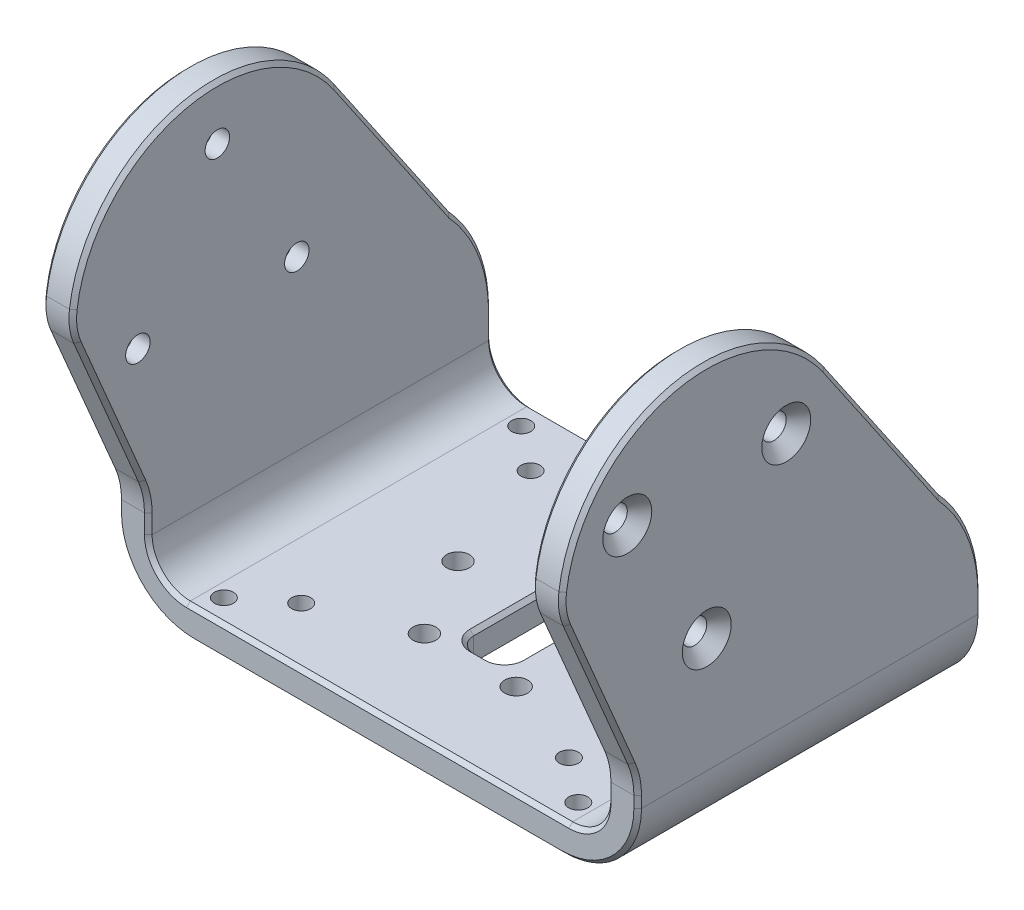
from build123d import *

# Parameters (mm, degrees)
SKETCH_1_W                   = 68
SKETCH_1_H                   = 45
EXTRUDE_1_DEPTH              = 4
SKETCH_2_R                   = 7
SKETCH_2_R_2                 = 1.6
EXTRUDE_2_DEPTH              = 4
FILLET_1_R                   = 20
FILLET_3_R                   = 5
FILLET_4_R                   = 10
FILLET_5_R                   = 10
EXTRUDE_5_DEPTH              = 4
EXTRUDE_START                = -4
EXTRUDE_6_DEPTH              = 4
FILLET_6_R                   = 8
SKETCH_34_R                  = 1.6
EXTRUDE_7_DEPTH              = 4
SKETCH_39_R                  = 7.5
CUT_EXTRUDE_5_DEPTH          = 10
HOLE_WIZARD_M3_2_OUTLINE_R   = 1.25
HOLE_WIZARD_M3_2_DEPTH       = 4
HOLE_WIZARD_M3_3_OUTLINE_R   = 1.25
HOLE_WIZARD_M3_3_DEPTH       = 4
CUT_EXTRUDE_6_REACH          = 98.711
SKETCH_53_W                  = 6.5
SKETCH_53_H                  = 14
FILLET_7_R                   = 1
HOLE_WIZARD_M3_8_D           = 3.2
HOLE_WIZARD_M3_8_DEPTH       = 6
HOLE_WIZARD_M3_8_CSINK_D     = 6.4
HOLE_WIZARD_M3_8_CSINK_ANGLE = 90
HOLE_WIZARD_M3_8_TIP         = 0.96137699
SKETCH_64_R                  = 1.6
EXTRUDE_10_DEPTH             = 4
SKETCH_58_R                  = 7.5
EXTRUDE_8_DEPTH              = 4
SKETCH_59_R                  = 7
EXTRUDE_9_DEPTH              = 4
SKETCH_61_W                  = 6.05
SKETCH_61_H                  = 17.9
CUT_EXTRUDE_7_DEPTH          = 10
FILLET_8_R                   = 2.03
CHAMFER_1_SIZE               = 0.5
CHAMFER_2_SIZE               = 0.5
FILLET_9_R                   = 10
CHAMFER_3_SIZE               = 0.5
CHAMFER_4_SIZE               = 0.5
SKETCH_45_R                  = 1.6
SKETCH_45_R_2                = 1.5
CUT_EXTRUDE_8_DEPTH          = 10
SKETCH_41_R                  = 1.5
CUT_EXTRUDE_9_DEPTH          = 10


# Read off the part's stored shape, not the designer's step: M3 螺纹孔2, M3 螺纹孔3, M3 十字槽半沉头木螺钉的锥形沉头孔7
with BuildPart() as part:
    # 草图1 → 凸台-拉伸1 (new body)
    with BuildSketch(Plane(origin=(0, 0, 0), x_dir=(1, 0, 0), z_dir=(0, 1, 0))):
        with Locations((34, 22.5)):
            Rectangle(SKETCH_1_W, SKETCH_1_H)
    extrude(amount=EXTRUDE_1_DEPTH)

    # 草图2 → 凸台-拉伸2 (add)
    with BuildSketch(Plane(origin=(68, 0, 0), x_dir=(0, 0, -1), z_dir=(1, 0, 0))):
        with BuildLine():
            Line((45, 0), (45, 20))
            Line((45, 20), (20.083304286, 47.143619407))
            ThreePointArc((20.083304286, 47.143619407), (1.609048893, 50.033934379), (-5.328161931, 32.66939756))
            Line((-5.328161931, 32.66939756), (0, 15))
            Line((0, 15), (0, 0))
            Line((0, 0), (45, 0))
        make_face()
        with Locations((9.033101332, 37)):
            Circle(SKETCH_2_R, mode=Mode.SUBTRACT)
        with Locations((9.033101332, 49)):
            Circle(SKETCH_2_R_2, mode=Mode.SUBTRACT)
        with Locations((19.425406178, 31)):
            Circle(SKETCH_2_R_2, mode=Mode.SUBTRACT)
        with Locations((-1.359203513, 31)):
            Circle(SKETCH_2_R_2, mode=Mode.SUBTRACT)
    extrude_2 = extrude(amount=-EXTRUDE_2_DEPTH)

    # 镜向1: 凸台-拉伸2 across plane
    add(extrude_2.mirror(Plane(origin=(34, 0, 0), x_dir=(0, 0, 1), z_dir=(1, 0, 0))))

    # 圆角1
    fillet_1_edges = [part.edges().sort_by_distance(p)[0] for p in [
        (66, 20, -45),
        (2, 20, -45),
    ]]
    fillet(fillet_1_edges, radius=FILLET_1_R)

    # 圆角3
    fillet_3_edges = [part.edges().sort_by_distance(p)[0] for p in [
        (64, 4, -22.5),
        (4, 4, -22.5),
    ]]
    fillet(fillet_3_edges, radius=FILLET_3_R)

    # 圆角4
    fillet_4_edges = [part.edges().sort_by_distance(p)[0] for p in [
        (68, 0, -22.5),
        (0, 0, -22.5),
    ]]
    fillet(fillet_4_edges, radius=FILLET_4_R)

    # 圆角5
    fillet_5_edges = [part.edges().sort_by_distance(p)[0] for p in [
        (66, 15, 0),
        (2, 15, 0),
    ]]
    fillet(fillet_5_edges, radius=FILLET_5_R)

    # 草图29 → 凸台-拉伸5 (add)
    with BuildSketch(Plane(origin=(68, 0, 0), x_dir=(0, 0, -1), z_dir=(1, 0, 0))):
        with BuildLine():
            Line((24.723058414, 47.715654286), (39.733603939, 25.737078944))
            Line((39.733603939, 25.737078944), (20.083304286, 47.143619407))
            ThreePointArc((20.083304286, 47.143619407), (1.609048893, 50.033934379), (-5.328161931, 32.66939756))
            Line((-5.328161931, 32.66939756), (-0.425824491, 16.412130924))
            ThreePointArc((-0.425824491, 16.412130924), (-0.107028882, 14.98421391), (0, 13.52506263))
            Line((0, 13.52506263), (-9.966898668, 37))
            ThreePointArc((-9.966898668, 37), (3.425480828, 55.153638541), (24.723058414, 47.715654286))
        make_face()
    extrude(amount=-EXTRUDE_5_DEPTH)

    # 草图30 → 凸台-拉伸6 (add)
    with BuildSketch(Plane.ZY.offset(EXTRUDE_START)):
        with BuildLine():
            Line((0, 13.52506263), (9.966898668, 37))
            ThreePointArc((9.966898668, 37), (-3.425480828, 55.153638541), (-24.723058414, 47.715654286))
            Line((-24.723058414, 47.715654286), (-39.733603939, 25.737078944))
            Line((-39.733603939, 25.737078944), (-20.083304286, 47.143619407))
            ThreePointArc((-20.083304286, 47.143619407), (-1.609048893, 50.033934379), (5.328161931, 32.66939756))
            Line((5.328161931, 32.66939756), (0.425824491, 16.412130924))
            ThreePointArc((0.425824491, 16.412130924), (0.107028882, 14.98421391), (0, 13.52506263))
        make_face()
    extrude(amount=EXTRUDE_6_DEPTH)

    # 圆角6
    fillet_6_edges = [part.edges().sort_by_distance(p)[0] for p in [
        (66, 37, 9.966898668),
        (2, 37, 9.966898668),
    ]]
    fillet(fillet_6_edges, radius=FILLET_6_R)

    # 草图34 → 凸台-拉伸7 (add)
    with BuildSketch(Plane.ZY):
        with Locations(Location((-9.033101332, 49, 0), (0, 0, 180))):
            Circle(SKETCH_34_R)
        with Locations(Location((1.359203513, 31, 0), (0, 0, 180))):
            Circle(SKETCH_34_R)
        with Locations(Location((-19.425406178, 31, 0), (0, 0, 180))):
            Circle(SKETCH_34_R)
    extrude(amount=-EXTRUDE_7_DEPTH)

    # 草图39 → 切除-拉伸5 (cut)
    with BuildSketch(Plane(origin=(68, 0, 0), x_dir=(0, 0, -1), z_dir=(1, 0, 0))):
        with Locations((9.033101332, 37)):
            Circle(SKETCH_39_R)
    extrude(amount=-CUT_EXTRUDE_5_DEPTH, mode=Mode.SUBTRACT)

    # Hole Wizard M3 _2 outline → Hole Wizard M3 _2 (cut)
    with BuildSketch(Plane(origin=(0, 0, 0), x_dir=(1, 0, 0), z_dir=(0, 1, 0))):
        with Locations((10.827155596, 3.055674807)):
            Circle(HOLE_WIZARD_M3_2_OUTLINE_R)
        with Locations((10.827155596, 41.944325193)):
            Circle(HOLE_WIZARD_M3_2_OUTLINE_R)
        with Locations((57.172844404, 3.055674807)):
            Circle(HOLE_WIZARD_M3_2_OUTLINE_R)
        with Locations((57.172844404, 41.944325193)):
            Circle(HOLE_WIZARD_M3_2_OUTLINE_R)
    extrude(amount=HOLE_WIZARD_M3_2_DEPTH, mode=Mode.SUBTRACT)

    # Hole Wizard M3 _3 outline → Hole Wizard M3 _3 (cut)
    with BuildSketch(Plane(origin=(0, 0, 0), x_dir=(1, 0, 0), z_dir=(0, 1, 0))):
        with Locations((51.5, 7.5)):
            Circle(HOLE_WIZARD_M3_3_OUTLINE_R)
        with Locations((16.5, 37.5)):
            Circle(HOLE_WIZARD_M3_3_OUTLINE_R)
        with Locations((16.5, 7.5)):
            Circle(HOLE_WIZARD_M3_3_OUTLINE_R)
        with Locations((51.5, 37.5)):
            Circle(HOLE_WIZARD_M3_3_OUTLINE_R)
    extrude(amount=HOLE_WIZARD_M3_3_DEPTH, mode=Mode.SUBTRACT)

    # 草图53 → 切除-拉伸6 (cut, up to next)
    with BuildSketch(Plane(origin=(0, 4, 0), x_dir=(1, 0, 0), z_dir=(0, 1, 0)), mode=Mode.PRIVATE) as cut_extrude_6_sk1:
        with Locations((52.75, 22.5)):
            Rectangle(SKETCH_53_W, SKETCH_53_H)
    cut_extrude_6_tool1 = extrude(cut_extrude_6_sk1.sketch, amount=-CUT_EXTRUDE_6_REACH, mode=Mode.PRIVATE) & part.part
    add(cut_extrude_6_tool1.solids().sort_by_distance((52.75, 4, -22.5))[0], mode=Mode.SUBTRACT)

    # 圆角7
    fillet_7_edges = [part.edges().sort_by_distance(p)[0] for p in [
        (56, 2, -29.5),
        (56, 2, -15.5),
        (49.5, 2, -15.5),
        (49.5, 2, -29.5),
    ]]
    fillet(fillet_7_edges, radius=FILLET_7_R)

    # M3 十字槽半沉头木螺钉的锥形沉头孔8
    with Locations(Plane(origin=(68, 0, 0), x_dir=(0, 0, -1), z_dir=(1, 0, 0))):
        with Locations((9.033101332, 37), (19.425406178, 43), (9.033101332, 25), (-1.359203513, 43)):
            CounterSinkHole(HOLE_WIZARD_M3_8_D / 2, HOLE_WIZARD_M3_8_CSINK_D / 2, depth=HOLE_WIZARD_M3_8_DEPTH, counter_sink_angle=HOLE_WIZARD_M3_8_CSINK_ANGLE)
            with Locations((0, 0, -(HOLE_WIZARD_M3_8_DEPTH + HOLE_WIZARD_M3_8_TIP / 2))):  # 118° drill point
                Cone(0, HOLE_WIZARD_M3_8_D / 2, HOLE_WIZARD_M3_8_TIP, mode=Mode.SUBTRACT)

    # 草图64 → 凸台-拉伸10 (add)
    with BuildSketch(Plane(origin=(68, 0, 0), x_dir=(0, 0, -1), z_dir=(1, 0, 0))):
        with Locations((9.033101332, 49)):
            Circle(SKETCH_64_R)
        with Locations((19.425406178, 31)):
            Circle(SKETCH_64_R)
        with Locations((-1.359203513, 31)):
            Circle(SKETCH_64_R)
    extrude(amount=-EXTRUDE_10_DEPTH)

    # M3 十字槽半沉头木螺钉的锥形沉头孔7 outline → M3 十字槽半沉头木螺钉的锥形沉头孔7 (revolve, cut)
    with BuildSketch(Plane(origin=(0, 31, -19.425406178), x_dir=(0, 1, 0), z_dir=(0, 0, -1))):
        Polygon((1.6, 1.8), (1.6, 4), (0, 4), (0, 0), (3.4, 0), align=None)
    revolve(axis=Axis((0, 31, -19.425406178), (1, 0, 0)), mode=Mode.SUBTRACT)

    # Hole Wizard M3 _7 2 outline → Hole Wizard M3 _7 2 (revolve, cut)
    with BuildSketch(Plane(origin=(0, 31, 1.359203513), x_dir=(0, 1, 0), z_dir=(0, 0, -1))):
        Polygon((1.6, 1.8), (1.6, 4), (0, 4), (0, 0), (3.4, 0), align=None)
    revolve(axis=Axis((0, 31, 1.359203513), (1, 0, 0)), mode=Mode.SUBTRACT)

    # Hole Wizard M3 _7 3 outline → Hole Wizard M3 _7 3 (revolve, cut)
    with BuildSketch(Plane(origin=(0, 49, -9.033101332), x_dir=(0, 1, 0), z_dir=(0, 0, -1))):
        Polygon((1.6, 1.8), (1.6, 4), (0, 4), (0, 0), (3.4, 0), align=None)
    revolve(axis=Axis((0, 49, -9.033101332), (1, 0, 0)), mode=Mode.SUBTRACT)

    # 草图58 → 凸台-拉伸8 (add)
    with BuildSketch(Plane(origin=(68, 0, 0), x_dir=(0, 0, -1), z_dir=(1, 0, 0))):
        with Locations((9.033101332, 37)):
            Circle(SKETCH_58_R)
    extrude(amount=-EXTRUDE_8_DEPTH)

    # 草图59 → 凸台-拉伸9 (add)
    with BuildSketch(Plane.ZY.offset(EXTRUDE_START)):
        with Locations((-9.033101332, 37)):
            Circle(SKETCH_59_R)
    extrude(amount=EXTRUDE_9_DEPTH)

    # 草图61 → 切除-拉伸7 (cut)
    with BuildSketch(Plane(origin=(0, 4, 0), x_dir=(1, 0, 0), z_dir=(0, 1, 0))):
        with Locations((34, 22.5)):
            Rectangle(SKETCH_61_W, SKETCH_61_H)
    extrude(amount=-CUT_EXTRUDE_7_DEPTH, mode=Mode.SUBTRACT)

    # 圆角8
    fillet_8_edges = [part.edges().sort_by_distance(p)[0] for p in [
        (37.025, 2, -31.45),
        (37.025, 2, -13.55),
        (30.975, 2, -13.55),
        (30.975, 2, -31.45),
    ]]
    fillet(fillet_8_edges, radius=FILLET_8_R)

    # 倒角1
    chamfer_1_edges = [part.edges().sort_by_distance(p)[0] for p in [
        (34, 0, -31.45),
        (34, 4, -31.45),
        (37.025, 0, -22.5),
        (37.025, 4, -22.5),
        (30.975, 0, -22.5),
        (30.975, 4, -22.5),
        (34, 0, -13.55),
        (34, 4, -13.55),
        (36.430426766, 4, -30.855426766),
        (36.430426766, 0, -30.855426766),
        (31.569573234, 4, -30.855426766),
        (31.569573234, 0, -30.855426766),
        (36.430426766, 4, -14.144573234),
        (36.430426766, 0, -14.144573234),
        (31.569573234, 4, -14.144573234),
        (31.569573234, 0, -14.144573234),
    ]]
    chamfer(chamfer_1_edges, length=CHAMFER_1_SIZE)

    # 倒角2
    chamfer_2_edges = [part.edges().sort_by_distance(p)[0] for p in [
        (56, 4, -22.5),
        (56, 0, -22.5),
        (52.75, 4, -15.5),
        (52.75, 0, -15.5),
        (49.5, 4, -22.5),
        (49.5, 0, -22.5),
        (52.75, 4, -29.5),
        (52.75, 0, -29.5),
        (55.707106781, 4, -15.792893219),
        (55.707106781, 0, -15.792893219),
        (49.792893219, 4, -15.792893219),
        (49.792893219, 0, -15.792893219),
        (49.792893219, 4, -29.207106781),
        (49.792893219, 0, -29.207106781),
        (55.707106781, 4, -29.207106781),
        (55.707106781, 0, -29.207106781),
    ]]
    chamfer(chamfer_2_edges, length=CHAMFER_2_SIZE)

    # 圆角9
    fillet_9_edges = [part.edges().sort_by_distance(p)[0] for p in [
        (66, 13.52506263, 0),
        (2, 13.52506263, 0),
    ]]
    fillet(fillet_9_edges, radius=FILLET_9_R)

    # 倒角3
    chamfer_3_edges = [part.edges().sort_by_distance(p)[0] for p in [
        (34, 0, -45),
        (2.928932188, 2.928932188, -45),
        (65.071067812, 2.928932188, -45),
        (34, 0, 0),
        (2.928932188, 2.928932188, 0),
        (65.071067812, 2.928932188, 0),
        (68, 36.726366615, -32.228331176),
        (68, 55.476963454, -4.605706893),
        (0, 36.726366615, -32.228331176),
        (68, 25.342485549, 5.017395995),
        (68, 37.325924296, 9.801496693),
        (0, 55.476963454, -4.605706893),
        (0, 37.325924296, 9.801496693),
        (0, 10.745046268, 0),
        (68, 10.745046268, 0),
        (0, 25.342485549, 5.017395995),
        (68, 13.484192585, 0.200838556),
        (0, 13.484192585, 0.200838556),
        (0, 11.106126534, -45),
        (68, 11.106126534, -45),
        (68, 19.469246978, -43.636953597),
        (0, 19.469246978, -43.636953597),
    ]]
    chamfer(chamfer_3_edges, length=CHAMFER_3_SIZE)

    # 倒角4
    chamfer_4_edges = [part.edges().sort_by_distance(p)[0] for p in [
        (4, 10.606126534, -45),
        (62.535533906, 5.464466094, 0),
        (62.535533906, 5.464466094, -45),
        (5.464466094, 5.464466094, -45),
        (5.464466094, 5.464466094, 0),
        (64, 36.726366615, -32.228331176),
        (4, 36.726366615, -32.228331176),
        (4, 55.476963454, -4.605706893),
        (64, 55.476963454, -4.605706893),
        (64, 37.325924296, 9.801496693),
        (4, 25.342485549, 5.017395995),
        (4, 37.325924296, 9.801496693),
        (4, 10.245046268, 0),
        (64, 10.245046268, 0),
        (64, 25.342485549, 5.017395995),
        (64, 13.484192585, 0.200838556),
        (4, 13.484192585, 0.200838556),
        (64, 19.469246978, -43.636953597),
        (4, 19.469246978, -43.636953597),
        (64, 10.606126534, -45),
        (34, 4, 0),
        (34, 4, -45),
    ]]
    chamfer(chamfer_4_edges, length=CHAMFER_4_SIZE)

    # 草图45 → 切除-拉伸8 (cut)
    with BuildSketch(Plane(origin=(0, 4, 0), x_dir=(1, 0, 0), z_dir=(0, 1, 0))):
        with Locations(Location((46, 22.5, 0), (0, 0, 270))):
            Circle(SKETCH_45_R)
        with Locations(Location((28, 32.892304845, 0), (0, 0, 270))):
            Circle(SKETCH_45_R_2)
        with Locations(Location((28, 12.107695155, 0), (0, 0, 270))):
            Circle(SKETCH_45_R_2)
    extrude(amount=-CUT_EXTRUDE_8_DEPTH, mode=Mode.SUBTRACT)

    # 草图41 → 切除-拉伸9 (cut)
    with BuildSketch(Plane(origin=(0, 4, 0), x_dir=(1, 0, 0), z_dir=(0, 1, 0))):
        with Locations(Location((40, 32.892304845, 0), (0, 0, 270))):
            Circle(SKETCH_41_R)
        with Locations(Location((22, 22.5, 0), (0, 0, 270))):
            Circle(SKETCH_41_R)
        with Locations(Location((40, 12.107695155, 0), (0, 0, 270))):
            Circle(SKETCH_41_R)
    extrude(amount=-CUT_EXTRUDE_9_DEPTH, mode=Mode.SUBTRACT)


solid = part.part
